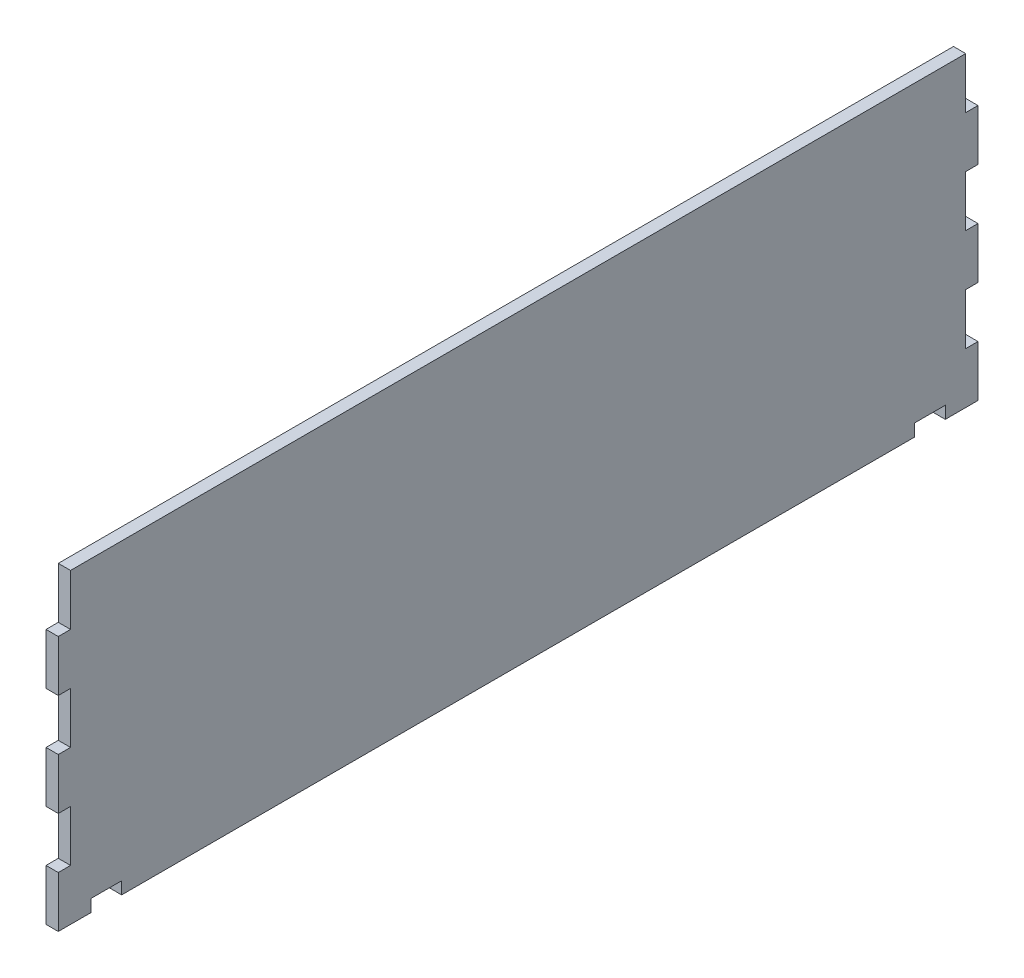
from build123d import *

# Parameters (mm, degrees)
SKETCH1_W            = 450
SKETCH1_H            = 150
BOSS_EXTRUDE1_DEPTH  = 6
SKETCH2_W            = 6
SKETCH2_H            = 25
CUT_EXTRUDE1_DEPTH   = 475.379594839
LPATTERN1_COUNT      = 3
LPATTERN1_PITCH      = 50
LPATTERN1_COUNT_DIR2 = 2
LPATTERN1_PITCH_DIR2 = 444
SKETCH3_W            = 15
SKETCH3_H            = 6
CUT_EXTRUDE2_DEPTH   = 475.379594839
LPATTERN2_COUNT      = 2
LPATTERN2_PITCH      = 403


with BuildPart() as part:
    # Sketch1 → Boss-Extrude1 (new body)
    with BuildSketch(Plane(origin=(0, 0, 0), x_dir=(0, 0, -1), z_dir=(1, 0, 0))):
        with Locations((-225, 75)):
            Rectangle(SKETCH1_W, SKETCH1_H)
    extrude(amount=BOSS_EXTRUDE1_DEPTH)

    # Sketch2 → Cut-Extrude1 (cut, through all)
    with BuildSketch(Plane(origin=(6, 0, 0), x_dir=(0, 0, -1), z_dir=(1, 0, 0))):
        with Locations((-447, 137.5)):
            Rectangle(SKETCH2_W, SKETCH2_H)
    cut_extrude1 = extrude(amount=-CUT_EXTRUDE1_DEPTH, mode=Mode.SUBTRACT)

    # LPattern1: Cut-Extrude1 3 × 2
    with Locations(*[(0, -i * LPATTERN1_PITCH, -j * LPATTERN1_PITCH_DIR2) for i in range(LPATTERN1_COUNT) for j in range(LPATTERN1_COUNT_DIR2) if (i, j) != (0, 0)]):
        add(cut_extrude1, mode=Mode.SUBTRACT)

    # Sketch3 → Cut-Extrude2 (cut, through all)
    with BuildSketch(Plane(origin=(6, 0, 0), x_dir=(0, 0, -1), z_dir=(1, 0, 0))):
        with Locations((-426.5, 3)):
            Rectangle(SKETCH3_W, SKETCH3_H)
    cut_extrude2 = extrude(amount=-CUT_EXTRUDE2_DEPTH, mode=Mode.SUBTRACT)

    # LPattern2: Cut-Extrude2 ×2
    with Locations(*[(0, 0, -i * LPATTERN2_PITCH) for i in range(1, LPATTERN2_COUNT)]):
        add(cut_extrude2, mode=Mode.SUBTRACT)


solid = part.part
